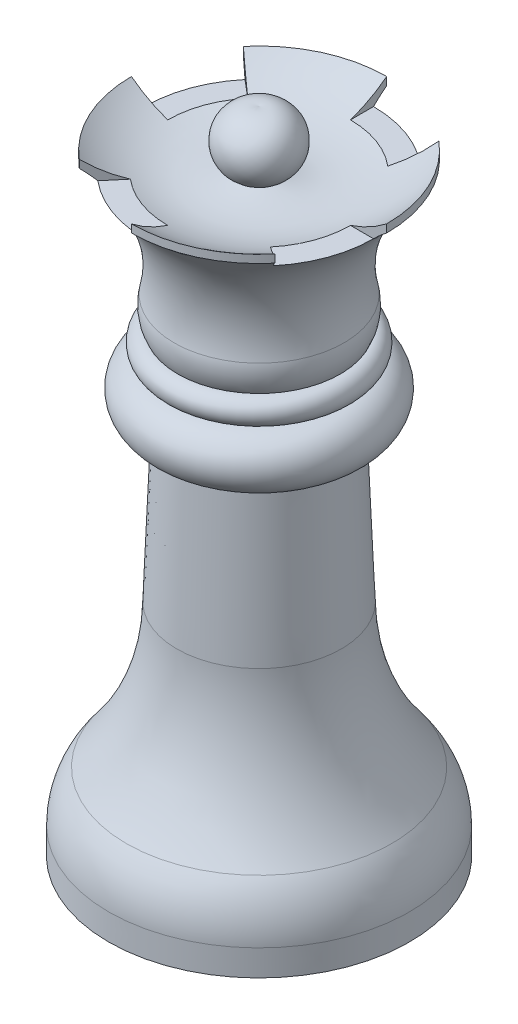
from build123d import *

# Parameters (mm, degrees)
SKETCH10_W          = 9.512793273
SKETCH10_H          = 3.277785934
CUT_REVOLVE8_ANGLE  = 40
SKETCH11_W          = 6.957754191
SKETCH11_H          = 4.403896439
CUT_REVOLVE9_ANGLE  = 40
SKETCH12_W          = 9.203214596
SKETCH12_H          = 3.33795348
CUT_REVOLVE10_ANGLE = 40
SKETCH13_W          = 8.638104201
SKETCH13_H          = 3.112891182
CUT_REVOLVE11_ANGLE = 40
CUT_EXTRUDE1_START  = -0.4
SKETCH8_R           = 10
CUT_EXTRUDE1_DEPTH  = 2


with BuildPart() as part:
    # Sketch1 → Revolve6 (revolve)
    with BuildSketch(Plane.XY):
        with BuildLine():
            Line((-11.6, 0), (0, 0))
            Line((0, 0), (0, 50))
            ThreePointArc((0, 50), (-2.670285452, 48.315824128), (-1.207945055, 45.517890367))
            ThreePointArc((-1.207945055, 45.517890367), (-5.713617748, 45.221219504), (-9.83725582, 47.060977386))
            Line((-9.83725582, 47.060977386), (-9.83725582, 46.446621373))
            ThreePointArc((-9.83725582, 46.446621373), (-6.855122072, 42.446707659), (-6.5462636, 37.467045236))
            ThreePointArc((-6.5462636, 37.467045236), (-6.602958864, 36.327795265), (-6.259730665, 35.239999672))
            ThreePointArc((-6.259730665, 35.239999672), (-7.244947935, 34.268175675), (-6.286634877, 33.269811497))
            ThreePointArc((-6.286634877, 33.269811497), (-8.418356224, 31.223574851), (-6.343236917, 29.119958876))
            Line((-6.343236917, 29.119958876), (-5.873433999, 29.119958876))
            Line((-5.873433999, 29.119958876), (-6.343236917, 16.936018409))
            ThreePointArc((-6.343236917, 16.936018409), (-7.365159743, 11.085952185), (-10.229600334, 5.88378137))
            ThreePointArc((-10.229600334, 5.88378137), (-11.234646656, 4.055708482), (-11.589655426, 2))
            Line((-11.589655426, 2), (-11.6, 0))
        make_face()
    revolve(axis=Axis((0, 50, 0), (0, -1, 0)))

    # Sketch10 → Cut-Revolve8 (revolve, cut)
    with BuildSketch(Plane.XY):
        with Locations((-9.83725582, 47.199870353)):
            Rectangle(SKETCH10_W, SKETCH10_H)
    revolve(axis=Axis((0, 0, 0), (0, -1, 0)), revolution_arc=CUT_REVOLVE8_ANGLE, mode=Mode.SUBTRACT)

    # Sketch11 → Cut-Revolve9 (revolve, cut)
    with BuildSketch(Plane.XY):
        with Locations((9.83725582, 47.762925606)):
            Rectangle(SKETCH11_W, SKETCH11_H)
    revolve(axis=Axis((0, 0, 0), (0, -1, 0)), revolution_arc=CUT_REVOLVE9_ANGLE, mode=Mode.SUBTRACT)

    # Sketch12 → Cut-Revolve10 (revolve, cut)
    with BuildSketch(Plane(origin=(0, 0, 0), x_dir=(0, 0, -1), z_dir=(1, 0, 0))):
        with Locations((9.83725582, 47.229954126)):
            Rectangle(SKETCH12_W, SKETCH12_H)
    revolve(axis=Axis((0, 0, 0), (0, -1, 0)), revolution_arc=CUT_REVOLVE10_ANGLE, mode=Mode.SUBTRACT)

    # Sketch13 → Cut-Revolve11 (revolve, cut)
    with BuildSketch(Plane(origin=(0, 0, 0), x_dir=(0, 0, -1), z_dir=(1, 0, 0))):
        with Locations((-9.83725582, 47.117422977)):
            Rectangle(SKETCH13_W, SKETCH13_H)
    revolve(axis=Axis((0, 0, 0), (0, -1, 0)), revolution_arc=CUT_REVOLVE11_ANGLE, mode=Mode.SUBTRACT)

    # Sketch8 → Cut-Extrude1 (cut)
    with BuildSketch(Plane.XZ.offset(CUT_EXTRUDE1_START)):
        Circle(SKETCH8_R)
    extrude(amount=-CUT_EXTRUDE1_DEPTH, mode=Mode.SUBTRACT)


solid = part.part
